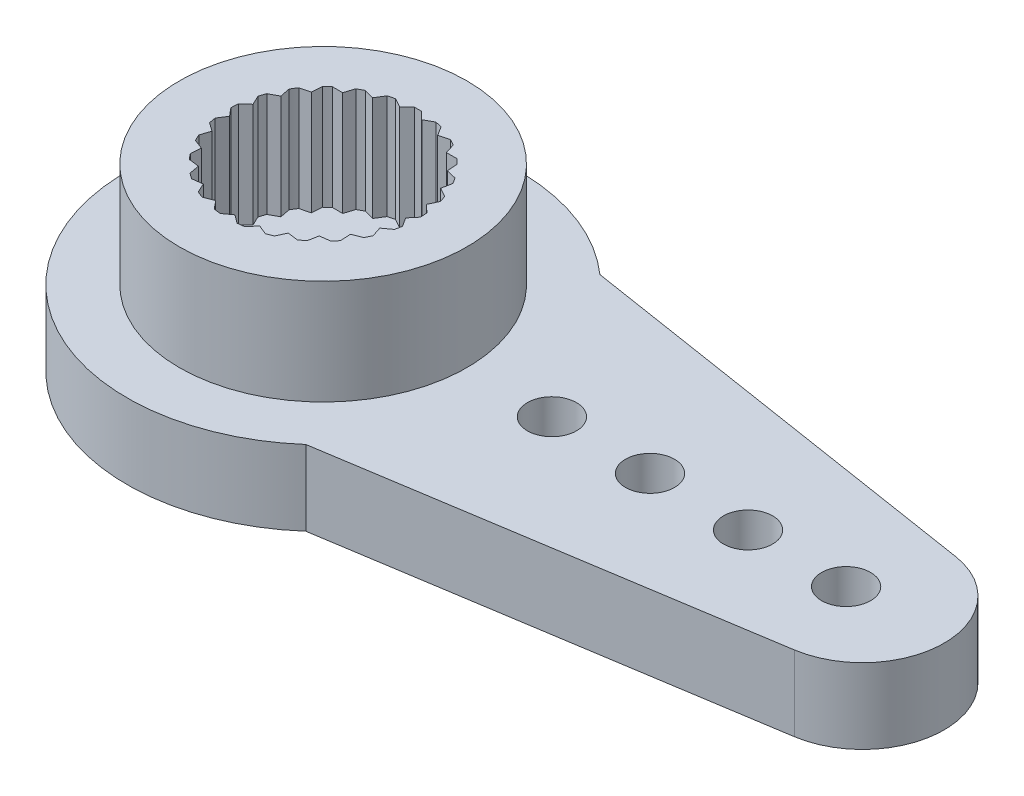
from build123d import *

# Parameters (mm, degrees)
SKETCH2_R           = 6
SKETCH2_R_2         = 1.5
BOSS_EXTRUDE1_DEPTH = 1.15
SKETCH3_R           = 4.4
BOSS_EXTRUDE2_DEPTH = 3.2
SKETCH4_R           = 0.75
BOSS_EXTRUDE3_DEPTH = 1.15


with BuildPart() as part:
    # Sketch2 → Boss-Extrude1 (new, symmetric)
    with BuildSketch(Plane(origin=(0, 0, 0), x_dir=(1, 0, 0), z_dir=(0, 1, 0))):
        Circle(SKETCH2_R)
        Circle(SKETCH2_R_2, mode=Mode.SUBTRACT)
    extrude(amount=BOSS_EXTRUDE1_DEPTH, both=True)

    # Sketch3 → Boss-Extrude2 (add)
    with BuildSketch(Plane(origin=(0, 1.15, 0), x_dir=(1, 0, 0), z_dir=(0, 1, 0))):
        Circle(SKETCH3_R)
        with BuildLine():
            Line((0.107421435, 2.898009771), (0.338399731, 2.678709694))
            Line((0.338399731, 2.678709694), (0.61665913, 2.83367809))
            ThreePointArc((0.61665913, 2.83367809), (0.721200673, 2.808891167), (0.824752316, 2.780248841))
            Line((0.824752316, 2.780248841), (0.993936292, 2.510396512))
            Line((0.993936292, 2.510396512), (1.301992734, 2.591295993))
            ThreePointArc((1.301992734, 2.591295993), (1.397085655, 2.541289372), (1.490260976, 2.48779465))
            Line((1.490260976, 2.48779465), (1.587020181, 2.184345885))
            Line((1.587020181, 2.184345885), (1.905517346, 2.186093238))
            ThreePointArc((1.905517346, 2.186093238), (1.985186607, 2.11400902), (2.062131058, 2.039023173))
            Line((2.062131058, 2.039023173), (2.080385755, 1.721044772))
            Line((2.080385755, 1.721044772), (2.389311295, 1.643530205))
            ThreePointArc((2.389311295, 1.643530205), (2.448550984, 1.553897705), (2.504429862, 1.46213237))
            Line((2.504429862, 1.46213237), (2.443033042, 1.149604087))
            Line((2.443033042, 1.149604087), (2.722976028, 0.997698125))
            ThreePointArc((2.722976028, 0.997698125), (2.758063897, 0.896149284), (2.789366126, 0.793370413))
            Line((2.789366126, 0.793370413), (2.652175577, 0.505929549))
            Line((2.652175577, 0.505929549), (2.885546163, 0.289177003))
            ThreePointArc((2.885546163, 0.289177003), (2.894277512, 0.182092507), (2.899036259, 0.074758075))
            Line((2.899036259, 0.074758075), (2.694672167, -0.169534403))
            Line((2.694672167, -0.169534403), (2.866806821, -0.437514174))
            ThreePointArc((2.866806821, -0.437514174), (2.848633027, -0.543405812), (2.826549281, -0.648551587))
            Line((2.826549281, -0.648551587), (2.567852594, -0.834345885))
            Line((2.567852594, -0.834345885), (2.667935462, -1.136714727))
            ThreePointArc((2.667935462, -1.136714727), (2.623998452, -1.234759946), (2.576459817, -1.331110368))
            Line((2.576459817, -1.331110368), (2.279685399, -1.446732346))
            Line((2.279685399, -1.446732346), (2.301427906, -1.764491312))
            ThreePointArc((2.301427906, -1.764491312), (2.234488404, -1.84852957), (2.164481907, -1.930030589))
            Line((2.164481907, -1.930030589), (1.848277186, -1.968215294))
            Line((1.848277186, -1.968215294), (1.790313171, -2.281398419))
            ThreePointArc((1.790313171, -2.281398419), (1.704577232, -2.346149284), (1.616501638, -2.40767989))
            Line((1.616501638, -2.40767989), (1.30073492, -2.366028036))
            Line((1.30073492, -2.366028036), (1.166706475, -2.654956874))
            ThreePointArc((1.166706475, -2.654956874), (1.067561203, -2.696351809), (0.966950626, -2.734045809))
            Line((0.966950626, -2.734045809), (0.671462695, -2.615174535))
            Line((0.671462695, -2.615174535), (0.469791321, -2.861694623))
            ThreePointArc((0.469791321, -2.861694623), (0.363466377, -2.877132634), (0.25664255, -2.888621575))
            Line((0.25664255, -2.888621575), (0, -2.7))
            Line((0, -2.7), (-0.25664255, -2.888621575))
            ThreePointArc((-0.25664255, -2.888621575), (-0.363466377, -2.877132634), (-0.469791321, -2.861694623))
            Line((-0.469791321, -2.861694623), (-0.671462695, -2.615174535))
            Line((-0.671462695, -2.615174535), (-0.966950626, -2.734045809))
            ThreePointArc((-0.966950626, -2.734045809), (-1.067561203, -2.696351809), (-1.166706475, -2.654956874))
            Line((-1.166706475, -2.654956874), (-1.30073492, -2.366028036))
            Line((-1.30073492, -2.366028036), (-1.616501638, -2.40767989))
            ThreePointArc((-1.616501638, -2.40767989), (-1.704577232, -2.346149284), (-1.790313171, -2.281398419))
            Line((-1.790313171, -2.281398419), (-1.848277186, -1.968215294))
            Line((-1.848277186, -1.968215294), (-2.164481907, -1.930030589))
            ThreePointArc((-2.164481907, -1.930030589), (-2.234488404, -1.84852957), (-2.301427906, -1.764491312))
            Line((-2.301427906, -1.764491312), (-2.279685399, -1.446732346))
            Line((-2.279685399, -1.446732346), (-2.576459817, -1.331110368))
            ThreePointArc((-2.576459817, -1.331110368), (-2.623998452, -1.234759946), (-2.667935462, -1.136714727))
            Line((-2.667935462, -1.136714727), (-2.567852594, -0.834345885))
            Line((-2.567852594, -0.834345885), (-2.826549281, -0.648551587))
            ThreePointArc((-2.826549281, -0.648551587), (-2.848633027, -0.543405812), (-2.866806821, -0.437514174))
            Line((-2.866806821, -0.437514174), (-2.694672167, -0.169534403))
            Line((-2.694672167, -0.169534403), (-2.899036259, 0.074758075))
            ThreePointArc((-2.899036259, 0.074758075), (-2.894277512, 0.182092507), (-2.885546163, 0.289177003))
            Line((-2.885546163, 0.289177003), (-2.652175577, 0.505929549))
            Line((-2.652175577, 0.505929549), (-2.789366126, 0.793370413))
            ThreePointArc((-2.789366126, 0.793370413), (-2.758063897, 0.896149284), (-2.722976028, 0.997698125))
            Line((-2.722976028, 0.997698125), (-2.443033042, 1.149604087))
            Line((-2.443033042, 1.149604087), (-2.504429862, 1.46213237))
            ThreePointArc((-2.504429862, 1.46213237), (-2.448550984, 1.553897705), (-2.389311295, 1.643530205))
            Line((-2.389311295, 1.643530205), (-2.080385755, 1.721044772))
            Line((-2.080385755, 1.721044772), (-2.062131058, 2.039023173))
            ThreePointArc((-2.062131058, 2.039023173), (-1.985186607, 2.11400902), (-1.905517346, 2.186093238))
            Line((-1.905517346, 2.186093238), (-1.587020181, 2.184345885))
            Line((-1.587020181, 2.184345885), (-1.490260976, 2.48779465))
            ThreePointArc((-1.490260976, 2.48779465), (-1.397085655, 2.541289372), (-1.301992734, 2.591295993))
            Line((-1.301992734, 2.591295993), (-0.993936292, 2.510396512))
            Line((-0.993936292, 2.510396512), (-0.824752316, 2.780248841))
            ThreePointArc((-0.824752316, 2.780248841), (-0.721200673, 2.808891167), (-0.61665913, 2.83367809))
            Line((-0.61665913, 2.83367809), (-0.338399731, 2.678709694))
            Line((-0.338399731, 2.678709694), (-0.107421435, 2.898009771))
            ThreePointArc((-0.107421435, 2.898009771), (0, 2.9), (0.107421435, 2.898009771))
        make_face(mode=Mode.SUBTRACT)
    extrude(amount=BOSS_EXTRUDE2_DEPTH)

    # Sketch4 → Boss-Extrude3 (add, symmetric)
    with BuildSketch(Plane(origin=(0, 0, 0), x_dir=(1, 0, 0), z_dir=(0, 1, 0))):
        with BuildLine():
            Line((3.968626967, 4.5), (16.888114198, 2.469689731))
            ThreePointArc((16.888114198, 2.469689731), (19, 0), (16.888114198, -2.469689731))
            Line((16.888114198, -2.469689731), (3.968626967, -4.5))
            ThreePointArc((3.968626967, -4.5), (6, 0), (3.968626967, 4.5))
        make_face()
        with Locations((16, 0)):
            Circle(SKETCH4_R, mode=Mode.SUBTRACT)
        with Locations((13, 0)):
            Circle(SKETCH4_R, mode=Mode.SUBTRACT)
        with Locations((10, 0)):
            Circle(SKETCH4_R, mode=Mode.SUBTRACT)
        with Locations((7, 0)):
            Circle(SKETCH4_R, mode=Mode.SUBTRACT)
    extrude(amount=BOSS_EXTRUDE3_DEPTH, both=True)


solid = part.part
